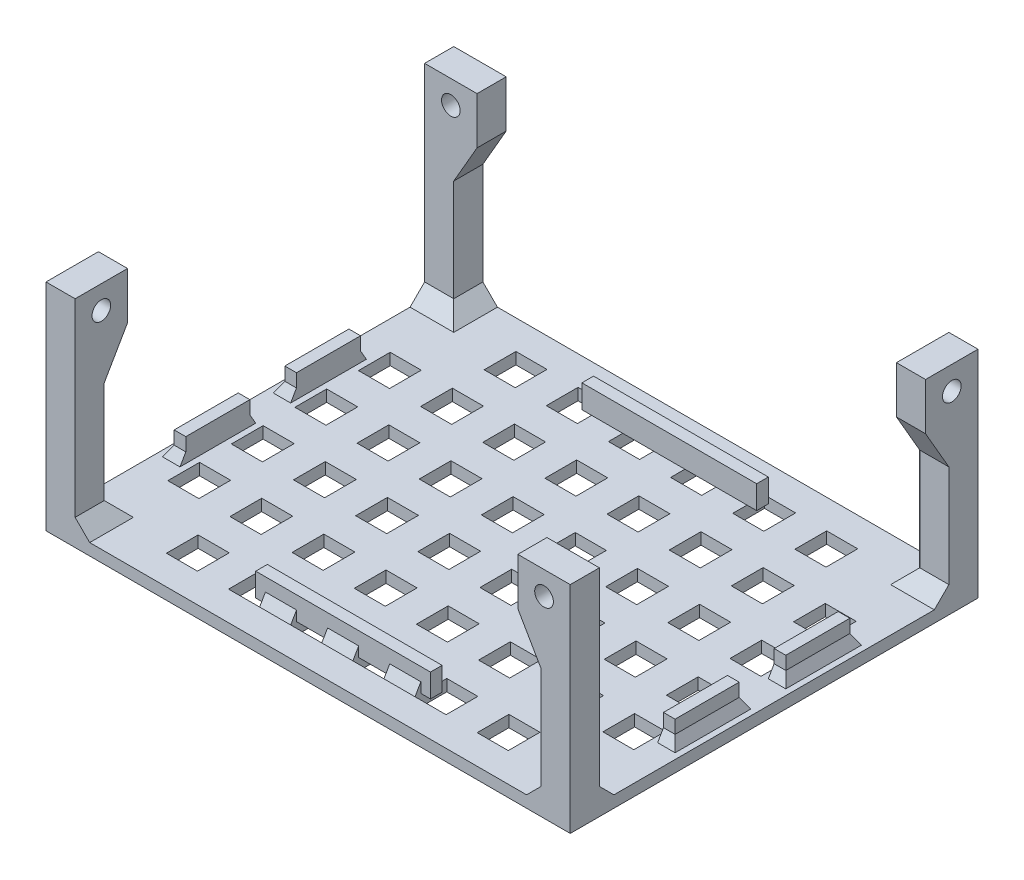
from build123d import *

# Parameters (mm, degrees)
ESBO_O1_W                = 90
ESBO_O1_H                = 70
RESSALTO_EXTRUS_O1_DEPTH = 2
ESBO_O3_W                = 5
ESBO_O3_H                = 5
RESSALTO_EXTRUS_O2_DEPTH = 35
ESBO_O4_W                = 30
ESBO_O4_H                = 2
ESBO_O4_W_2              = 2
ESBO_O4_H_2              = 11
RESSALTO_EXTRUS_O4_DEPTH = 4
ESBO_O2_W                = 5.334
ESBO_O2_H                = 5.45
ESBO_O2_W_2              = 5.31
CORTE_EXTRUS_O2_DEPTH    = 67.895440801
CHANFRO2_SIZE            = 2.5
CHANFRO3_SIZE            = 1
CHANFRO3_SIZE2           = 1.732050808
ESBO_O6_W                = 5
ESBO_O6_H                = 8
RESSALTO_EXTRUS_O6_DEPTH = 4
ESBO_O7_W                = 5
ESBO_O7_H                = 8
RESSALTO_EXTRUS_O7_DEPTH = 4
ESBO_O8_W                = 5
ESBO_O8_H                = 8
RESSALTO_EXTRUS_O8_DEPTH = 4
ESBO_O9_W                = 5
ESBO_O9_H                = 8
RESSALTO_EXTRUS_O9_DEPTH = 4
CHANFRO4_SIZE            = 4.041451884
CHANFRO4_SIZE_2          = 7
ESBO_O10_R               = 1.6
CORTE_EXTRUS_O3_DEPTH    = 5
ESBO_O11_R               = 1.6
CORTE_EXTRUS_O4_DEPTH    = 5
ESBO_O12_R               = 1.6
CORTE_EXTRUS_O5_DEPTH    = 5
ESBO_O13_R               = 1.6
CORTE_EXTRUS_O6_DEPTH    = 5


with BuildPart() as part:
    # Esboço1 → Ressalto-extrusão1 (new body)
    with BuildSketch(Plane(origin=(0, 0, 0), x_dir=(1, 0, 0), z_dir=(0, 1, 0))):
        Rectangle(ESBO_O1_W, ESBO_O1_H)
    extrude(amount=RESSALTO_EXTRUS_O1_DEPTH)

    # Esboço3 → Ressalto-extrusão2 (add)
    with BuildSketch(Plane(origin=(0, 2, 0), x_dir=(1, 0, 0), z_dir=(0, 1, 0))):
        with Locations((42.5, 32.5)):
            Rectangle(ESBO_O3_W, ESBO_O3_H)
        with Locations((-42.5, 32.5)):
            Rectangle(ESBO_O3_W, ESBO_O3_H)
        with Locations((42.5, -32.5)):
            Rectangle(ESBO_O3_W, ESBO_O3_H)
        with Locations((-42.5, -32.5)):
            Rectangle(ESBO_O3_W, ESBO_O3_H)
    extrude(amount=RESSALTO_EXTRUS_O2_DEPTH)

    # Esboço4 → Ressalto-extrusão4 (add)
    with BuildSketch(Plane(origin=(0, 2, 0), x_dir=(1, 0, 0), z_dir=(0, 1, 0))):
        with Locations((0, 28)):
            Rectangle(ESBO_O4_W, ESBO_O4_H)
        with Locations((0, -28)):
            Rectangle(ESBO_O4_W, ESBO_O4_H)
        with Locations((42, 9.5)):
            Rectangle(ESBO_O4_W_2, ESBO_O4_H_2)
        with Locations((42, -9.5)):
            Rectangle(ESBO_O4_W_2, ESBO_O4_H_2)
        with Locations((-42, 9.5)):
            Rectangle(ESBO_O4_W_2, ESBO_O4_H_2)
        with Locations((-42, -9.5)):
            Rectangle(ESBO_O4_W_2, ESBO_O4_H_2)
    extrude(amount=RESSALTO_EXTRUS_O4_DEPTH)

    # Esboço2 → Corte-extrusão2 (cut, through all)
    with BuildSketch(Plane(origin=(0, 2, 0), x_dir=(1, 0, 0), z_dir=(0, 1, 0))):
        with Locations((-26.663, 27.275)):
            Rectangle(ESBO_O2_W, ESBO_O2_H)
        with Locations((-37.333, 16.365)):
            Rectangle(ESBO_O2_W, ESBO_O2_H)
        with Locations((-26.663, 16.365)):
            Rectangle(ESBO_O2_W, ESBO_O2_H)
        with Locations((-37.333, 5.455)):
            Rectangle(ESBO_O2_W, ESBO_O2_H)
        with Locations((-26.663, 5.455)):
            Rectangle(ESBO_O2_W, ESBO_O2_H)
        with Locations((-37.333, -5.455)):
            Rectangle(ESBO_O2_W, ESBO_O2_H)
        with Locations((-26.663, -5.455)):
            Rectangle(ESBO_O2_W, ESBO_O2_H)
        with Locations((-37.333, -16.365)):
            Rectangle(ESBO_O2_W, ESBO_O2_H)
        with Locations((-26.663, -16.365)):
            Rectangle(ESBO_O2_W, ESBO_O2_H)
        with Locations((-15.993, -16.365)):
            Rectangle(ESBO_O2_W, ESBO_O2_H)
        with Locations((-15.993, -5.455)):
            Rectangle(ESBO_O2_W, ESBO_O2_H)
        with Locations((-15.993, 5.455)):
            Rectangle(ESBO_O2_W, ESBO_O2_H)
        with Locations((-15.993, 16.365)):
            Rectangle(ESBO_O2_W, ESBO_O2_H)
        with Locations((-15.993, 27.275)):
            Rectangle(ESBO_O2_W, ESBO_O2_H)
        with Locations((-5.323, 27.275)):
            Rectangle(ESBO_O2_W, ESBO_O2_H)
        with Locations((-5.323, 16.365)):
            Rectangle(ESBO_O2_W, ESBO_O2_H)
        with Locations((-5.323, 5.455)):
            Rectangle(ESBO_O2_W, ESBO_O2_H)
        with Locations((-5.323, -5.455)):
            Rectangle(ESBO_O2_W, ESBO_O2_H)
        with Locations((-5.323, -16.365)):
            Rectangle(ESBO_O2_W, ESBO_O2_H)
        with Locations((5.347, -16.365)):
            Rectangle(ESBO_O2_W, ESBO_O2_H)
        with Locations((5.347, -5.455)):
            Rectangle(ESBO_O2_W, ESBO_O2_H)
        with Locations((5.347, 5.455)):
            Rectangle(ESBO_O2_W, ESBO_O2_H)
        with Locations((5.347, 16.365)):
            Rectangle(ESBO_O2_W, ESBO_O2_H)
        with Locations((5.347, 27.275)):
            Rectangle(ESBO_O2_W, ESBO_O2_H)
        with Locations((16.017, 27.275)):
            Rectangle(ESBO_O2_W, ESBO_O2_H)
        with Locations((16.017, 16.365)):
            Rectangle(ESBO_O2_W, ESBO_O2_H)
        with Locations((16.017, 5.455)):
            Rectangle(ESBO_O2_W, ESBO_O2_H)
        with Locations((16.017, -5.455)):
            Rectangle(ESBO_O2_W, ESBO_O2_H)
        with Locations((16.017, -16.365)):
            Rectangle(ESBO_O2_W, ESBO_O2_H)
        with Locations((26.687, -16.365)):
            Rectangle(ESBO_O2_W, ESBO_O2_H)
        with Locations((26.687, -5.455)):
            Rectangle(ESBO_O2_W, ESBO_O2_H)
        with Locations((26.687, 5.455)):
            Rectangle(ESBO_O2_W, ESBO_O2_H)
        with Locations((26.687, 16.365)):
            Rectangle(ESBO_O2_W, ESBO_O2_H)
        with Locations((26.687, 27.275)):
            Rectangle(ESBO_O2_W, ESBO_O2_H)
        with Locations((37.345, 16.365)):
            Rectangle(ESBO_O2_W_2, ESBO_O2_H)
        with Locations((37.345, 5.455)):
            Rectangle(ESBO_O2_W_2, ESBO_O2_H)
        with Locations((37.345, -5.455)):
            Rectangle(ESBO_O2_W_2, ESBO_O2_H)
        with Locations((37.345, -16.365)):
            Rectangle(ESBO_O2_W_2, ESBO_O2_H)
        with Locations((-26.663, -27.275)):
            Rectangle(ESBO_O2_W, ESBO_O2_H)
        with Locations((-15.993, -27.275)):
            Rectangle(ESBO_O2_W, ESBO_O2_H)
        with Locations((-5.323, -27.275)):
            Rectangle(ESBO_O2_W, ESBO_O2_H)
        with Locations((5.347, -27.275)):
            Rectangle(ESBO_O2_W, ESBO_O2_H)
        with Locations((16.017, -27.275)):
            Rectangle(ESBO_O2_W, ESBO_O2_H)
        with Locations((26.687, -27.275)):
            Rectangle(ESBO_O2_W, ESBO_O2_H)
    extrude(amount=-CORTE_EXTRUS_O2_DEPTH, mode=Mode.SUBTRACT)

    # Chanfro2
    chanfro2_edges = [part.edges().sort_by_distance(p)[0] for p in [
        (-42.5, 2, -30),
        (-40, 2, -32.5),
        (40, 2, -32.5),
        (42.5, 2, -30),
        (40, 2, 32.5),
        (42.5, 2, 30),
        (-40, 2, 32.5),
        (-42.5, 2, 30),
    ]]
    chamfer(chanfro2_edges, length=CHANFRO2_SIZE)

    # Chanfro3
    chanfro3_edges = [part.edges().sort_by_distance(p)[0] for p in [
        (-10.658, 2, -29),
        (0.012, 2, -29),
        (10.682, 2, -29),
        (-42, 2, -15),
        (-43, 2, -9.5),
        (-42, 2, -4),
        (-42, 2, 4),
        (-43, 2, 9.5),
        (-42, 2, 15),
        (42, 2, -15),
        (42, 2, -4),
        (43, 2, -9.5),
        (42, 2, 4),
        (42, 2, 15),
        (43, 2, 9.5),
        (10.682, 2, 29),
        (-10.658, 2, 29),
        (0.012, 2, 29),
    ]]
    chanfro3_side = [part.faces().sort_by_distance(p)[0] for p in [
        (0.001037115, 2, 0),
    ]]
    chamfer(chanfro3_edges, length=CHANFRO3_SIZE, length2=CHANFRO3_SIZE2, reference=chanfro3_side[0])

    # Esboço6 → Ressalto-extrusão6 (add)
    with BuildSketch(Plane(origin=(0, 0, 30), x_dir=(-1, 0, 0), z_dir=(0, 0, -1))):
        with Locations((42.5, 33)):
            Rectangle(ESBO_O6_W, ESBO_O6_H)
    extrude(amount=RESSALTO_EXTRUS_O6_DEPTH)

    # Esboço7 → Ressalto-extrusão7 (add)
    with BuildSketch(Plane.ZY.offset(-40)):
        with Locations((32.5, 33)):
            Rectangle(ESBO_O7_W, ESBO_O7_H)
    extrude(amount=RESSALTO_EXTRUS_O7_DEPTH)

    # Esboço8 → Ressalto-extrusão8 (add)
    with BuildSketch(Plane(origin=(-40, 0, 0), x_dir=(0, 0, -1), z_dir=(1, 0, 0))):
        with Locations((32.5, 33)):
            Rectangle(ESBO_O8_W, ESBO_O8_H)
    extrude(amount=RESSALTO_EXTRUS_O8_DEPTH)

    # Esboço9 → Ressalto-extrusão9 (add)
    with BuildSketch(Plane.XY.offset(-30)):
        with Locations((42.5, 33)):
            Rectangle(ESBO_O9_W, ESBO_O9_H)
    extrude(amount=RESSALTO_EXTRUS_O9_DEPTH)

    # Chanfro4
    # the kernel refuses this chamfer: 7, 4.041451884 mm, written as the material it adds along each edge
    with BuildSketch(Plane(origin=(-45, 29, 30), x_dir=(0, 0.05789386240267071, -0.9983227437537926), z_dir=(1, 0, 0))) as chanfro4_piece_1_section:
        Polygon((CHANFRO4_SIZE * 0.998322743835, -CHANFRO4_SIZE * 0.0578938624074), (-CHANFRO4_SIZE_2 * 0.0578938624027, -CHANFRO4_SIZE_2 * 0.998322743754), (0, 0), align=None)
    chanfro4_piece_1 = extrude(amount=5, mode=Mode.PRIVATE)
    chanfro4_piece_1 = split(chanfro4_piece_1, bisect_by=Plane(origin=(-42.5, 26.644155251, 26), z_dir=(0, 0, 1)), keep=Keep.TOP, mode=Mode.PRIVATE)
    add(chanfro4_piece_1)
    with BuildSketch(Plane(origin=(40, 29, 35), x_dir=(-0.9983227437537926, 0.05789386240267066, 0), z_dir=(0, 0, -1))) as chanfro4_piece_2_section:
        Polygon((CHANFRO4_SIZE * 0.998322743835, -CHANFRO4_SIZE * 0.0578938624074), (-CHANFRO4_SIZE_2 * 0.0578938624027, -CHANFRO4_SIZE_2 * 0.998322743754), (0, 0), align=None)
    chanfro4_piece_2 = extrude(amount=5, mode=Mode.PRIVATE)
    chanfro4_piece_2 = split(chanfro4_piece_2, bisect_by=Plane(origin=(36, 26.644155251, 32.5), z_dir=(1, 0, 0)), keep=Keep.TOP, mode=Mode.PRIVATE)
    add(chanfro4_piece_2)
    with BuildSketch(Plane(origin=(45, 29, -30), x_dir=(0, 0.05789386240267071, 0.9983227437537926), z_dir=(-1, 0, 0))) as chanfro4_piece_3_section:
        Polygon((CHANFRO4_SIZE * 0.998322743835, -CHANFRO4_SIZE * 0.0578938624074), (-CHANFRO4_SIZE_2 * 0.0578938624027, -CHANFRO4_SIZE_2 * 0.998322743754), (0, 0), align=None)
    chanfro4_piece_3 = extrude(amount=5, mode=Mode.PRIVATE)
    chanfro4_piece_3 = split(chanfro4_piece_3, bisect_by=Plane(origin=(42.5, 26.644155251, -26), z_dir=(0, 0, -1)), keep=Keep.TOP, mode=Mode.PRIVATE)
    add(chanfro4_piece_3)
    with BuildSketch(Plane(origin=(-40, 29, -35), x_dir=(0.9983227437537926, 0.05789386240267066, 0), z_dir=(0, 0, 1))) as chanfro4_piece_4_section:
        Polygon((CHANFRO4_SIZE * 0.998322743835, -CHANFRO4_SIZE * 0.0578938624074), (-CHANFRO4_SIZE_2 * 0.0578938624027, -CHANFRO4_SIZE_2 * 0.998322743754), (0, 0), align=None)
    chanfro4_piece_4 = extrude(amount=5, mode=Mode.PRIVATE)
    chanfro4_piece_4 = split(chanfro4_piece_4, bisect_by=Plane(origin=(-36, 26.644155251, -32.5), z_dir=(-1, 0, 0)), keep=Keep.TOP, mode=Mode.PRIVATE)
    add(chanfro4_piece_4)

    # Esboço10 → Corte-extrusão3 (cut)
    with BuildSketch(Plane.ZY.offset(45)):
        with Locations((30.5, 33)):
            Circle(ESBO_O10_R)
    extrude(amount=-CORTE_EXTRUS_O3_DEPTH, mode=Mode.SUBTRACT)

    # Esboço11 → Corte-extrusão4 (cut)
    with BuildSketch(Plane(origin=(0, 0, -35), x_dir=(-1, 0, 0), z_dir=(0, 0, -1))):
        with Locations((40.5, 33)):
            Circle(ESBO_O11_R)
    extrude(amount=-CORTE_EXTRUS_O4_DEPTH, mode=Mode.SUBTRACT)

    # Esboço12 → Corte-extrusão5 (cut)
    with BuildSketch(Plane(origin=(45, 0, 0), x_dir=(0, 0, -1), z_dir=(1, 0, 0))):
        with Locations((30.5, 33)):
            Circle(ESBO_O12_R)
    extrude(amount=-CORTE_EXTRUS_O5_DEPTH, mode=Mode.SUBTRACT)

    # Esboço13 → Corte-extrusão6 (cut)
    with BuildSketch(Plane.XY.offset(35)):
        with Locations((40.5, 33)):
            Circle(ESBO_O13_R)
    extrude(amount=-CORTE_EXTRUS_O6_DEPTH, mode=Mode.SUBTRACT)


solid = part.part
